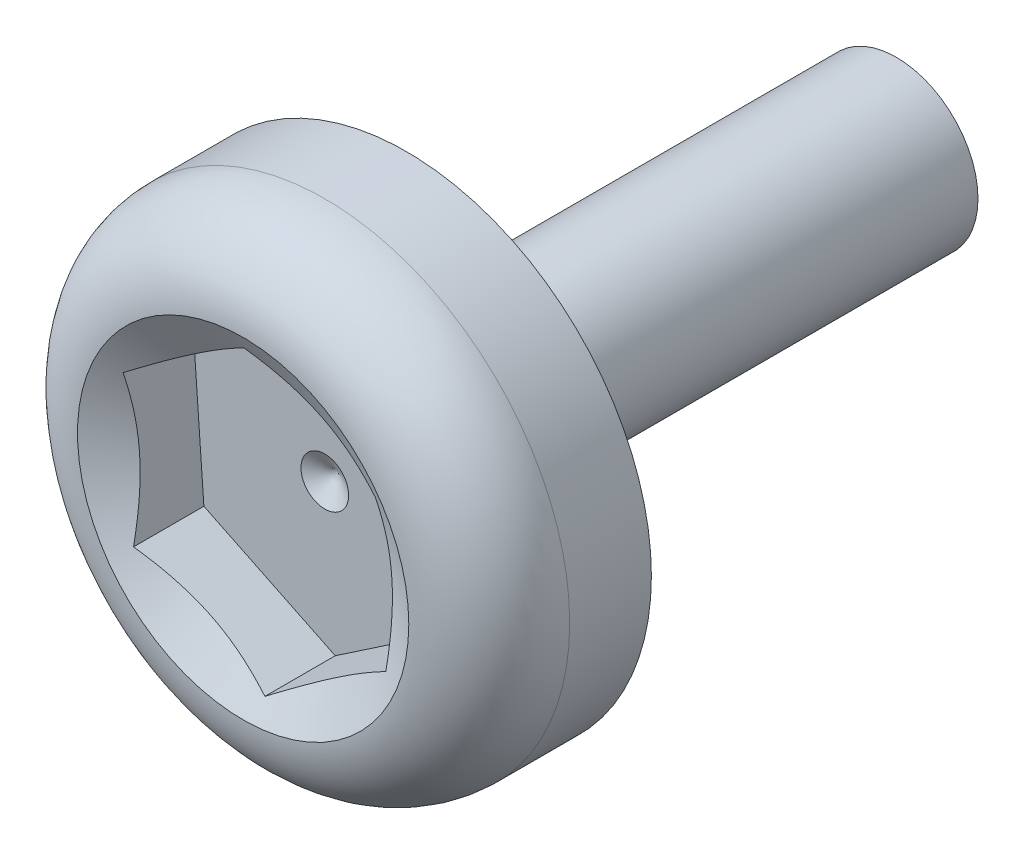
from build123d import *

# Parameters (mm, degrees)
SKETCH1_R           = 0.5
BOSS_EXTRUDE1_DEPTH = 3
SKETCH2_R           = 1.5
BOSS_EXTRUDE2_DEPTH = 1
CUT_EXTRUDE2_DEPTH  = 0.5
FILLET1_R           = 0.5


with BuildPart() as part:
    # Sketch1 → Boss-Extrude1 (new body)
    with BuildSketch(Plane.XY):
        Circle(SKETCH1_R)
    extrude(amount=BOSS_EXTRUDE1_DEPTH)

    # Sketch2 → Boss-Extrude2 (add)
    with BuildSketch(Plane.XY.offset(3)):
        Circle(SKETCH2_R)
    extrude(amount=BOSS_EXTRUDE2_DEPTH)

    # Sketch3 → Cut-Revolve1 (revolve, cut)
    with BuildSketch(Plane(origin=(0, 0, 0), x_dir=(1, 0, 0), z_dir=(0, 1, 0))):
        Polygon((0, -3.415887941), (1.01436748, -4), (0, -4), align=None)
    revolve(axis=Axis((0, 0, 4), (0, 0, -1)), mode=Mode.SUBTRACT)

    # Sketch4 → Cut-Extrude2 (cut)
    with BuildSketch(Plane.XY.offset(4)):
        Polygon((-0.064066106, 0.892020738), (-0.804545672, 0.390527494), (-0.740479567, -0.501493244), (0.064066106, -0.892020738), (0.804545672, -0.390527494), (0.740479567, 0.501493244), align=None)
    extrude(amount=-CUT_EXTRUDE2_DEPTH, mode=Mode.SUBTRACT)

    # Fillet1
    # the kernel refuses this fillet: 0.5 mm, written as the material it takes off along each edge
    with BuildSketch(Plane(origin=(0, 0, 4), x_dir=(1, 0, 0), z_dir=(0, -1, 0))) as fillet1_piece_1:
        with BuildLine():
            CenterArc((1, -0.499793533), FILLET1_R, 0, 88.353381389)
            Line((1.01436748, 0), (1.01465483, 0.009995871))
            ThreePointArc((1.01465483, 0.009995871), (1.25718374, 0.01), (1.5, 0.01))
            Line((1.5, 0.01), (1.51, 0))
            Line((1.51, 0), (1.51, -0.499793533))
            Line((1.51, -0.499793533), (1.5, -0.499793533))
        make_face()
    revolve(axis=Axis((0, 0, 4), (0, 0, 1)), mode=Mode.SUBTRACT)


solid = part.part
